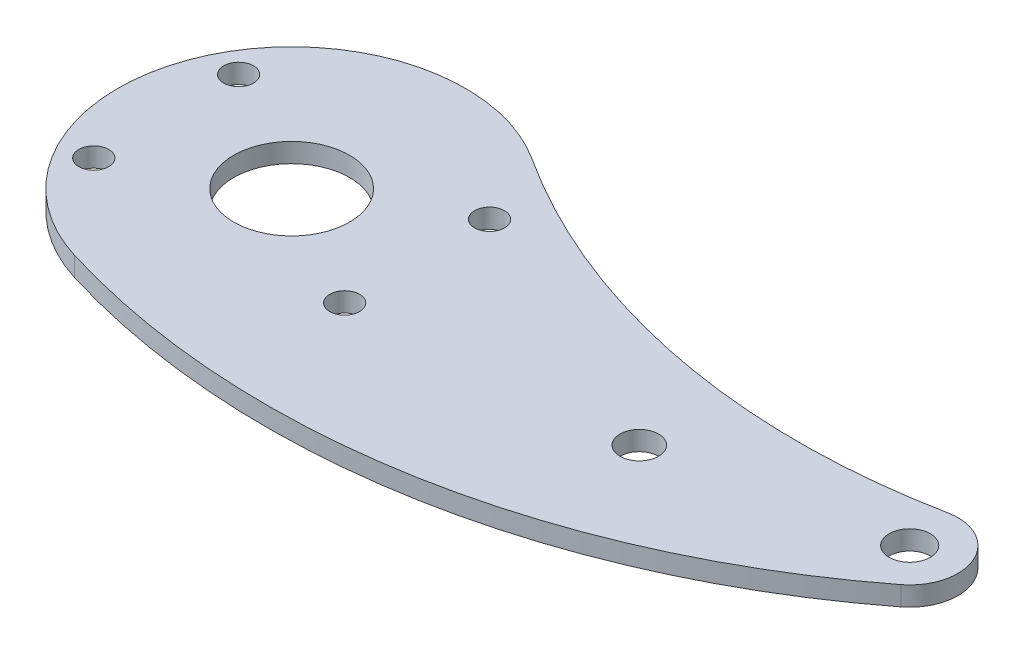
from build123d import *

# Parameters (mm, degrees)
SKETCH1_R                    = 9.525
SKETCH1_R_2                  = 3.3782
BOSS_EXTRUDE1_DEPTH          = 3.175
F_10_0_1935_DIAMETER_HOLE1_D = 4.9149
F_1_4_0_25_DIAMETER_HOLE2_D  = 6.35


with BuildPart() as part:
    # Sketch1 → Boss-Extrude1 (new body)
    with BuildSketch(Plane(origin=(0, 0, 0), x_dir=(1, 0, 0), z_dir=(0, 1, 0))):
        with BuildLine():
            ThreePointArc((100.049707031, 7.784632166), (56.215627572, 7.625525419), (15.545097656, 23.976667072))
            ThreePointArc((15.545097656, 23.976667072), (-25.906449023, 12.057633434), (-8.335575227, -27.332193667))
            ThreePointArc((-8.335575227, -27.332193667), (51.623799583, -30.771841696), (106.459238281, -6.276281509))
            ThreePointArc((106.459238281, -6.276281509), (108.822506706, 3.292309696), (100.049707031, 7.784632166))
        make_face()
        Circle(SKETCH1_R, mode=Mode.SUBTRACT)
        with Locations((101.6, 0)):
            Circle(SKETCH1_R_2, mode=Mode.SUBTRACT)
    extrude(amount=BOSS_EXTRUDE1_DEPTH)

    # #10 (0.1935) Diameter Hole1 (through all)
    with Locations(Plane(origin=(0, 3.175, 0), x_dir=(1, 0, 0), z_dir=(0, 1, 0))):
        with Locations((-20.622229928, -11.90625), (-20.622229928, 11.90625), (20.622229928, 11.90625), (20.622229928, -11.90625)):
            Hole(F_10_0_1935_DIAMETER_HOLE1_D / 2)

    # 1/4 (0.25) Diameter Hole2 (through all)
    with Locations(Plane(origin=(0, 3.175, 0), x_dir=(1, 0, 0), z_dir=(0, 1, 0))):
        with Locations((65.0875, -7.9375)):
            Hole(F_1_4_0_25_DIAMETER_HOLE2_D / 2)


solid = part.part
